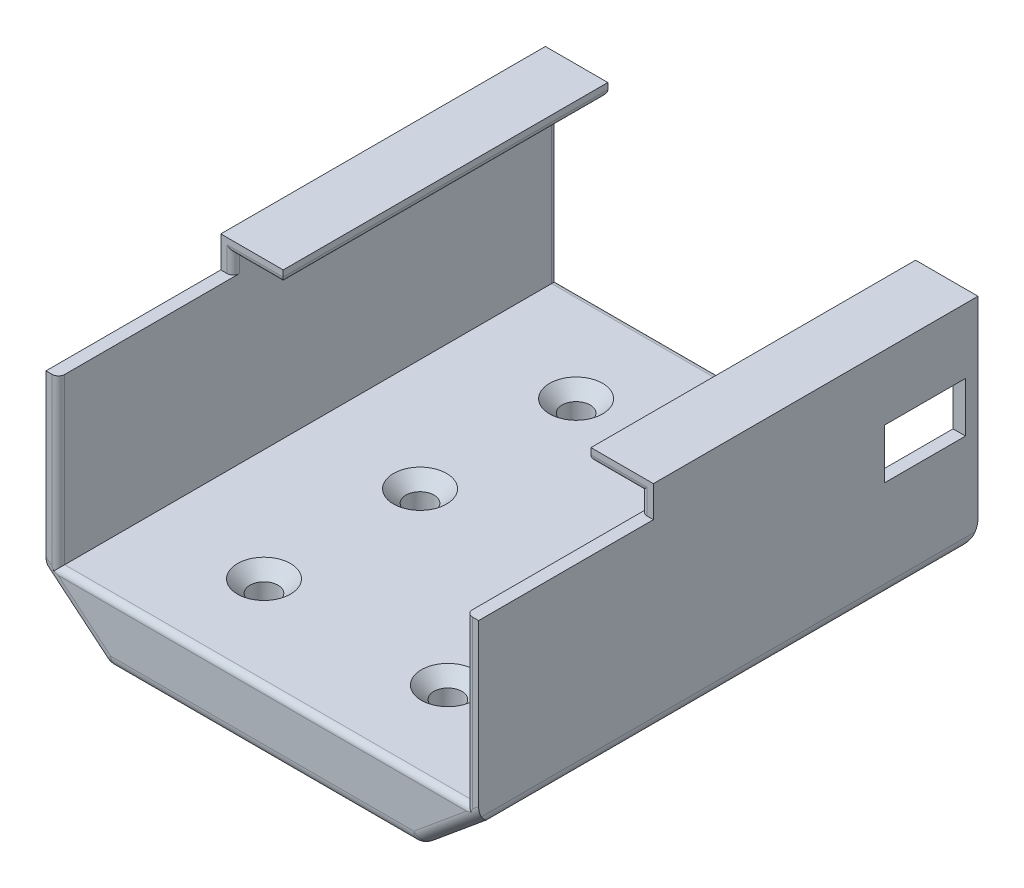
from build123d import *

# Parameters (mm, degrees)
SKETCH1_W               = 50
SKETCH1_H               = 80
BOSS_EXTRUDE1_DEPTH     = 10
SKETCH2_R               = 2.25
CUT_EXTRUDE1_DEPTH      = 49.218253805
CHAMFER1_SIZE           = 2
BOSS_EXTRUDE2_DEPTH     = 40
CUT_EXTRUDE2_DEPTH      = 68.19064295
CUT_EXTRUDE2_DEPTH_BACK = 68.19064295
SKETCH4_W               = 28
SKETCH4_H               = 5
CUT_EXTRUDE3_REACH      = 92.091
SKETCH5_W               = 13
SKETCH5_H               = 8
FILLET1_R               = 1
FILLET2_R               = 2


with BuildPart() as part:
    # Sketch1 → Boss-Extrude1 (new body)
    with BuildSketch(Plane(origin=(0, 0, 0), x_dir=(1, 0, 0), z_dir=(0, 1, 0))):
        Rectangle(SKETCH1_W, SKETCH1_H)
    extrude(amount=BOSS_EXTRUDE1_DEPTH)

    # Sketch2 → Cut-Extrude1 (cut, through all)
    with BuildSketch(Plane(origin=(0, 10, 0), x_dir=(1, 0, 0), z_dir=(0, 1, 0))):
        with Locations(Location((-14.730430452, 0, 0), (0, 0, 270))):
            Circle(SKETCH2_R)
        with Locations(Location((-14.730430452, 25, 0), (0, 0, 270))):
            Circle(SKETCH2_R)
        with Locations(Location((-14.730430452, -25, 0), (0, 0, 270))):
            Circle(SKETCH2_R)
        with Locations(Location((14.730430452, -25, 0), (0, 0, 90))):
            Circle(SKETCH2_R)
        with Locations(Location((14.730430452, 0, 0), (0, 0, 90))):
            Circle(SKETCH2_R)
        with Locations(Location((14.730430452, 25, 0), (0, 0, 90))):
            Circle(SKETCH2_R)
    extrude(amount=-CUT_EXTRUDE1_DEPTH, mode=Mode.SUBTRACT)

    # Chamfer1
    chamfer1_edges = [part.edges().sort_by_distance(p)[0] for p in [
        (-14.730430452, 10, -27.25),
        (-14.730430452, 10, 22.75),
        (14.730430452, 10, 27.25),
        (14.730430452, 10, 2.25),
        (14.730430452, 10, -22.75),
        (-14.730430452, 10, -2.25),
    ]]
    chamfer(chamfer1_edges, length=CHAMFER1_SIZE)

    # Sketch3 → Boss-Extrude2 (add, symmetric)
    with BuildSketch(Plane.XY):
        Polygon((-25, 10), (-32.65, 10), (-32.65, 39.4), (-24.65, 39.4), (-24.65, 41.4), (-34.65, 41.4), (-34.65, 8), (-25, 0), align=None)
        Polygon((34.65, 8), (25, 0), (25, 10), (32.65, 10), (32.65, 39.4), (24.65, 39.4), (24.65, 41.4), (34.65, 41.4), align=None)
    extrude(amount=BOSS_EXTRUDE2_DEPTH, both=True)

    # Sketch4 → Cut-Extrude2 (cut, two sides: drawn at the far end of the back side and taken through both)
    with BuildSketch(Plane(origin=(0, 0, 0), x_dir=(0, 0, -1), z_dir=(1, 0, 0)).offset(-CUT_EXTRUDE2_DEPTH_BACK)):
        with Locations((-26, 38.9)):
            Rectangle(SKETCH4_W, SKETCH4_H)
    extrude(amount=CUT_EXTRUDE2_DEPTH + CUT_EXTRUDE2_DEPTH_BACK, mode=Mode.SUBTRACT)

    # Sketch5 → Cut-Extrude3 (cut, up to next)
    with BuildSketch(Plane(origin=(34.65, 0, 0), x_dir=(0, 0, -1), z_dir=(1, 0, 0)), mode=Mode.PRIVATE) as cut_extrude3_sk1:
        with Locations((31.5, 27)):
            Rectangle(SKETCH5_W, SKETCH5_H)
    cut_extrude3_tool1 = extrude(cut_extrude3_sk1.sketch, amount=-CUT_EXTRUDE3_REACH, mode=Mode.PRIVATE) & part.part
    add(cut_extrude3_tool1.solids().sort_by_distance((34.65, 27, -31.5))[0], mode=Mode.SUBTRACT)

    # Fillet1
    fillet1_edges = [part.edges().sort_by_distance(p)[0] for p in [
        (32.65, 23.2, 40),
        (32.65, 37.9, 12),
        (24.65, 39.4, -14),
        (-24.65, 39.4, -14),
        (-28.65, 39.4, 12),
        (-32.65, 37.9, 12),
        (28.65, 39.4, 12),
        (0, 10, 40),
        (-32.65, 24.7, -40),
        (-28.65, 39.4, -40),
        (-32.65, 23.2, 40),
        (0, 10, -40),
        (28.65, 39.4, -40),
        (32.65, 24.7, -40),
    ]]
    fillet(fillet1_edges, radius=FILLET1_R)

    # Fillet2
    # the kernel refuses this fillet: 2 mm, written as the material it takes off along each edge
    with BuildSketch(Plane(origin=(-24.278787146, 2, 38), x_dir=(0, -1, 0), z_dir=(0, 0, 1))) as fillet2_piece_1_section:
        Polygon((0, 0), (FILLET2_R * 1.02, 0), (FILLET2_R * 1.02, -FILLET2_R * 0.367818555432), (FILLET2_R * 0.785250632337, -FILLET2_R * 0.650984980176), align=None)
    fillet2_piece_1 = extrude(amount=FILLET2_R * 1.02, mode=Mode.PRIVATE)
    fillet2_piece_1 = fillet2_piece_1 - Plane(origin=(-24.278787146, 2, 38), x_dir=(0.3392244381566016, 0.9407054696116836, 0), z_dir=(0, 0, 1)) * Sphere(FILLET2_R, mode=Mode.PRIVATE)
    add(fillet2_piece_1, mode=Mode.SUBTRACT)
    with BuildSketch(Plane(origin=(24.278787146, 2, -38), x_dir=(0, -1, 0), z_dir=(0, 0, -1))) as fillet2_piece_2_section:
        Polygon((0, 0), (FILLET2_R * 1.02, 0), (FILLET2_R * 1.02, -FILLET2_R * 0.367818555432), (FILLET2_R * 0.785250632337, -FILLET2_R * 0.650984980176), align=None)
    fillet2_piece_2 = extrude(amount=FILLET2_R * 1.02, mode=Mode.PRIVATE)
    fillet2_piece_2 = fillet2_piece_2 - Plane(origin=(24.278787146, 2, -38), x_dir=(-0.3392244381566016, 0.9407054696116836, 0), z_dir=(0, 0, -1)) * Sphere(FILLET2_R, mode=Mode.PRIVATE)
    add(fillet2_piece_2, mode=Mode.SUBTRACT)
    with BuildSketch(Plane(origin=(24.278787146, 2, 38), x_dir=(0, -1, 0), z_dir=(0, 0, 1))) as fillet2_piece_3_section:
        Polygon((0, 0), (FILLET2_R * 1.02, 0), (FILLET2_R * 1.02, FILLET2_R * 0.367818555432), (FILLET2_R * 0.785250632337, FILLET2_R * 0.650984980176), align=None)
    fillet2_piece_3 = extrude(amount=FILLET2_R * 1.02, mode=Mode.PRIVATE)
    fillet2_piece_3 = fillet2_piece_3 - Plane(origin=(24.278787146, 2, 38), x_dir=(-0.3392244381566016, 0.9407054696116836, 0), z_dir=(0, 0, 1)) * Sphere(FILLET2_R, mode=Mode.PRIVATE)
    add(fillet2_piece_3, mode=Mode.SUBTRACT)
    with BuildSketch(Plane(origin=(-24.278787146, 2, -38), x_dir=(0, -1, 0), z_dir=(0, 0, -1))) as fillet2_piece_4_section:
        Polygon((0, 0), (FILLET2_R * 1.02, 0), (FILLET2_R * 1.02, FILLET2_R * 0.367818555432), (FILLET2_R * 0.785250632337, FILLET2_R * 0.650984980176), align=None)
    fillet2_piece_4 = extrude(amount=FILLET2_R * 1.02, mode=Mode.PRIVATE)
    fillet2_piece_4 = fillet2_piece_4 - Plane(origin=(-24.278787146, 2, -38), x_dir=(0.3392244381566016, 0.9407054696116836, 0), z_dir=(0, 0, -1)) * Sphere(FILLET2_R, mode=Mode.PRIVATE)
    add(fillet2_piece_4, mode=Mode.SUBTRACT)
    with BuildSketch(Plane(origin=(-38.499267806, 11.191102844, 40), x_dir=(0.6382205687997308, 0.7698535611146761, -3.5527136788005e-15), z_dir=(0.7698535611146761, -0.6382205687997308, 0)), Plane(origin=(-38.499267806, 11.191102844, -40), x_dir=(0, 0, 1), z_dir=(0.7698535611146761, -0.6382205687997308, 0))) as fillet2_piece_5:
        with BuildLine():
            CenterArc((FILLET2_R, -FILLET2_R), FILLET2_R, 90, 90)
            Line((0, -FILLET2_R), (-FILLET2_R * 0.02, -FILLET2_R))
            Line((-FILLET2_R * 0.02, -FILLET2_R), (-FILLET2_R * 0.02, FILLET2_R * 0.02))
            Line((-FILLET2_R * 0.02, FILLET2_R * 0.02), (FILLET2_R, FILLET2_R * 0.02))
            Line((FILLET2_R, FILLET2_R * 0.02), (FILLET2_R, 0))
        make_face()
    extrude(amount=16.813638561, mode=Mode.SUBTRACT)
    with BuildSketch(Plane(origin=(38.499267806, 11.191102844, -40), x_dir=(0, 0, 1), z_dir=(-0.7698535611146761, -0.6382205687997308, 0)), Plane(origin=(38.499267806, 11.191102844, 40), x_dir=(-0.6382205687997308, 0.7698535611146761, -3.5527136788005e-15), z_dir=(-0.7698535611146761, -0.6382205687997308, 0))) as fillet2_piece_6:
        with BuildLine():
            CenterArc((FILLET2_R, FILLET2_R), FILLET2_R, 180, 90)
            Line((0, FILLET2_R), (-FILLET2_R * 0.02, FILLET2_R))
            Line((-FILLET2_R * 0.02, FILLET2_R), (-FILLET2_R * 0.02, -FILLET2_R * 0.02))
            Line((-FILLET2_R * 0.02, -FILLET2_R * 0.02), (FILLET2_R, -FILLET2_R * 0.02))
            Line((FILLET2_R, -FILLET2_R * 0.02), (FILLET2_R, 0))
        make_face()
    extrude(amount=16.813638561, mode=Mode.SUBTRACT)
    with BuildSketch(Plane(origin=(-24.278787146, 0, -40), x_dir=(0, 0, 1), z_dir=(1, 0, 0)), Plane(origin=(24.278787146, 0, 40), x_dir=(0, 0, -1), z_dir=(-1, 0, 0))) as fillet2_piece_7:
        with BuildLine():
            CenterArc((FILLET2_R, -FILLET2_R), FILLET2_R, 90, 90)
            Line((0, -FILLET2_R), (-FILLET2_R * 0.02, -FILLET2_R))
            Line((-FILLET2_R * 0.02, -FILLET2_R), (-FILLET2_R * 0.02, FILLET2_R * 0.02))
            Line((-FILLET2_R * 0.02, FILLET2_R * 0.02), (FILLET2_R, FILLET2_R * 0.02))
            Line((FILLET2_R, FILLET2_R * 0.02), (FILLET2_R, 0))
        make_face()
    extrude(amount=48.557574292, mode=Mode.SUBTRACT)
    with BuildSketch(Plane(origin=(-34.65, 8, 42.349663946), x_dir=(0, 1, 0), z_dir=(0, 0, -1)), Plane(origin=(34.65, 8, -42.349663946), x_dir=(0, 1, 0), z_dir=(0, 0, 1))) as fillet2_piece_8:
        with BuildLine():
            CenterArc((FILLET2_R * 0.469932789135, FILLET2_R), FILLET2_R, 219.659259409, 50.340740591)
            Line((-FILLET2_R * 0.299920771979, FILLET2_R * 0.3617794312), (-FILLET2_R * 0.315317843202, FILLET2_R * 0.349015019824))
            Line((-FILLET2_R * 0.315317843202, FILLET2_R * 0.349015019824), (-FILLET2_R * 0.0093986557827, -FILLET2_R * 0.02))
            Line((-FILLET2_R * 0.0093986557827, -FILLET2_R * 0.02), (FILLET2_R * 0.469932789135, -FILLET2_R * 0.02))
            Line((FILLET2_R * 0.469932789135, -FILLET2_R * 0.02), (FILLET2_R * 0.469932789135, 0))
        make_face()
    extrude(amount=84.699327891, mode=Mode.SUBTRACT)
    with BuildSketch(Plane(origin=(25, 0, -38), x_dir=(-1, 0, 0), z_dir=(0, 0, 1)), Plane(origin=(-25, 0, 38), x_dir=(1, 0, 0), z_dir=(0, 0, -1))) as fillet2_piece_9:
        with BuildLine():
            CenterArc((FILLET2_R * 0.360606426894, -FILLET2_R), FILLET2_R, 90, 39.659259409)
            Line((-FILLET2_R * 0.277614141905, -FILLET2_R * 0.230146438885), (-FILLET2_R * 0.290378553281, -FILLET2_R * 0.214749367663))
            Line((-FILLET2_R * 0.290378553281, -FILLET2_R * 0.214749367663), (-FILLET2_R * 0.00721212853789, FILLET2_R * 0.02))
            Line((-FILLET2_R * 0.00721212853789, FILLET2_R * 0.02), (FILLET2_R * 0.360606426894, FILLET2_R * 0.02))
            Line((FILLET2_R * 0.360606426894, FILLET2_R * 0.02), (FILLET2_R * 0.360606426894, 0))
        make_face()
    extrude(amount=76, mode=Mode.SUBTRACT)


solid = part.part
